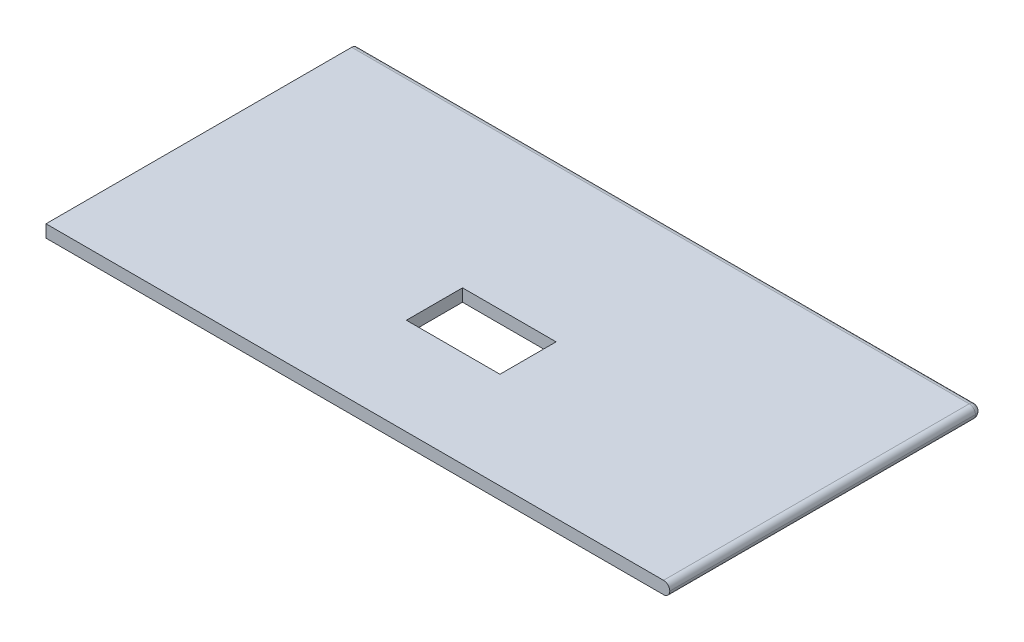
from build123d import *

# Parameters (mm, degrees)
SCHIZZO1_W                   = 100
SCHIZZO1_H                   = 50
ESTRUSIONE_ESTRUSIONE1_DEPTH = 2
RACCORDO1_R                  = 1
RACCORDO2_R                  = 1
SCHIZZO2_W                   = 15
SCHIZZO2_H                   = 9
TAGLIO_ESTRUSIONE1_DEPTH     = 10


with BuildPart() as part:
    # Schizzo1 → Estrusione-Estrusione1 (new body)
    with BuildSketch(Plane(origin=(0, 0, 0), x_dir=(1, 0, 0), z_dir=(0, 1, 0))):
        Rectangle(SCHIZZO1_W, SCHIZZO1_H)
    extrude(amount=ESTRUSIONE_ESTRUSIONE1_DEPTH)

    # Raccordo1
    raccordo1_edges = [part.edges().sort_by_distance(p)[0] for p in [
        (0, 0, -25),
        (0, 2, -25),
    ]]
    fillet(raccordo1_edges, radius=RACCORDO1_R - 0.0001)  # a hair under: the kernel refuses the full size

    # Raccordo2
    raccordo2_edges = [part.edges().sort_by_distance(p)[0] for p in [
        (50, 0.292863929, -24.707136071),
        (50, 1.707136071, -24.707136071),
        (50, 0, 0.49995),
        (50, 2, 0.49995),
    ]]
    fillet(raccordo2_edges, radius=RACCORDO2_R - 0.0001)  # a hair under: the kernel refuses the full size

    # Schizzo2 → Taglio-Estrusione1 (cut)
    with BuildSketch(Plane(origin=(0, 2, 0), x_dir=(1, 0, 0), z_dir=(0, 1, 0))):
        with Locations((-0.220921897, -5.005960214)):
            Rectangle(SCHIZZO2_W, SCHIZZO2_H)
    extrude(amount=-TAGLIO_ESTRUSIONE1_DEPTH, mode=Mode.SUBTRACT)


solid = part.part
